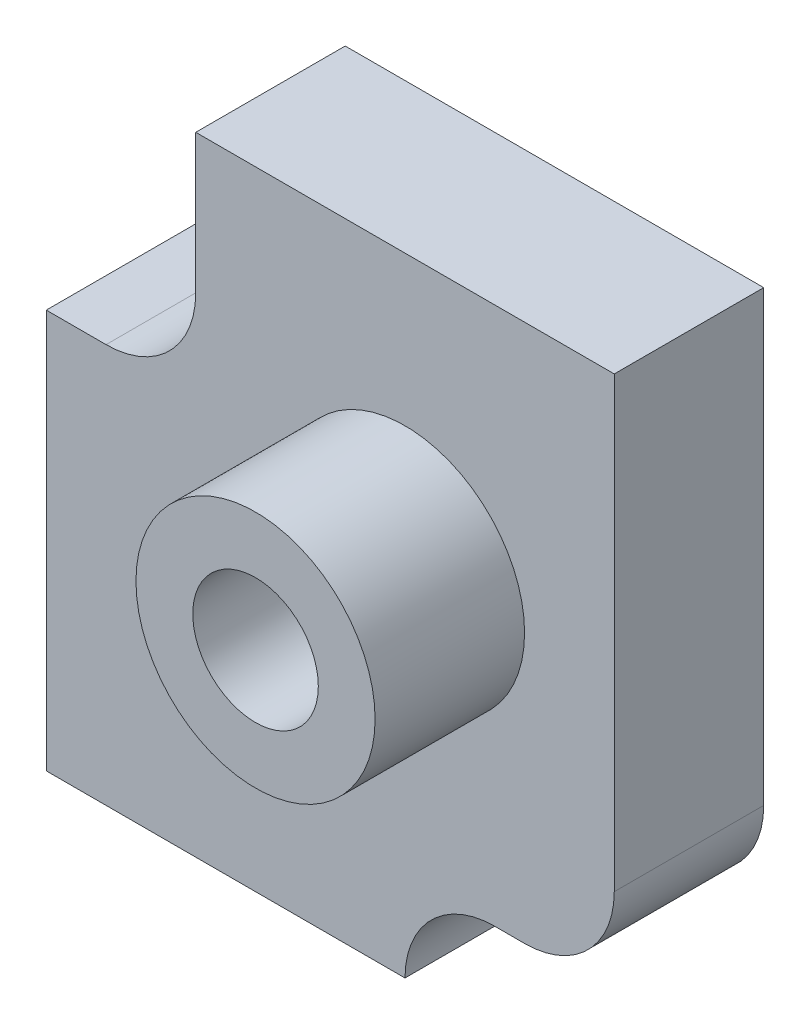
from build123d import *

# Parameters (mm, degrees)
SKETCH1_W      = 14
SKETCH1_H      = 18
EXTRUDE1_DEPTH = 5
SKETCH2_R      = 4
EXTRUDE2_DEPTH = 5
SKETCH3_R      = 2.1
EXTRUDE3_DEPTH = 6
EXTRUDE5_DEPTH = 5
FILLET1_R      = 3


with BuildPart() as part:
    # Sketch1 → Extrude1 (new body)
    with BuildSketch(Plane.XY):
        Rectangle(SKETCH1_W, SKETCH1_H)
    extrude(amount=EXTRUDE1_DEPTH)

    # Sketch2 → Extrude2 (add)
    with BuildSketch(Plane.XY.offset(5)):
        Circle(SKETCH2_R)
    extrude(amount=EXTRUDE2_DEPTH)

    # Sketch3 → Extrude3 (cut)
    with BuildSketch(Plane.XY.offset(10)):
        Circle(SKETCH3_R)
    extrude(amount=-EXTRUDE3_DEPTH, mode=Mode.SUBTRACT)

    # Sketch4 → Extrude5 (add)
    with BuildSketch(Plane.XY):
        Polygon((-7, 1.348977854), (-12, 1.348977854), (-12, -12), (0, -12), (0, -9), (-7, -9), align=None)
    extrude(amount=EXTRUDE5_DEPTH)

    # Fillet1
    fillet1_edges = [part.edges().sort_by_distance(p)[0] for p in [
        (0, -9, 2.5),
        (7, -9, 2.5),
        (-7, 1.348977854, 2.5),
    ]]
    fillet(fillet1_edges, radius=FILLET1_R - 0.0001)  # a hair under: the kernel refuses the full size


solid = part.part
